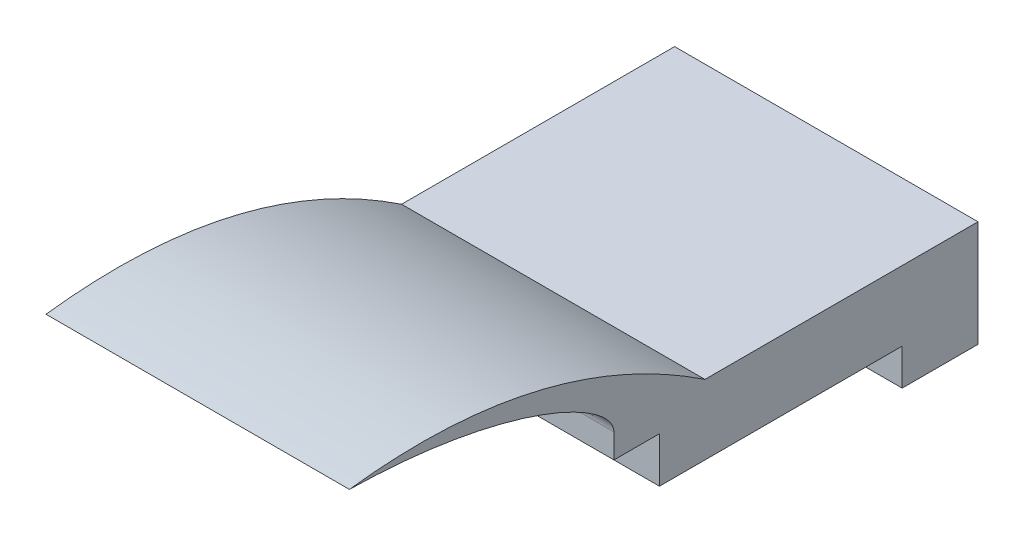
from build123d import *

# Parameters (mm, degrees)
BOSS_EXTRUDE1_DEPTH     = 63.5
CUT_EXTRUDE1_DEPTH      = 168.419011538
CUT_EXTRUDE1_DEPTH_BACK = 168.419011538
SKETCH2_R               = 3.175
BOSS_EXTRUDE2_START     = 114.3
SKETCH3_W               = 127
SKETCH3_H               = 44.45
SKETCH3_R               = 3.175
BOSS_EXTRUDE2_DEPTH     = 114.3
SKETCH4_W               = 101.6
SKETCH4_H               = 15.24
CUT_EXTRUDE2_DEPTH      = 211.546717743


with BuildPart() as part:
    # Sketch1 → Boss-Extrude1 (new, symmetric)
    with BuildSketch(Plane(origin=(0, 0, 0), x_dir=(0, 0, -1), z_dir=(1, 0, 0))):
        with BuildLine():
            Line((9.953260665, 1.527522938), (9.953260665, -8.632477062))
            Line((9.953260665, -8.632477062), (29.003260665, -8.632477062))
            Line((29.003260665, -8.632477062), (29.003260665, -42.922477062))
            Line((29.003260665, -42.922477062), (48.053260665, -42.922477062))
            Line((48.053260665, -42.922477062), (48.053260665, 1.527522938))
            add(Edge.make_bspline(
                [(-100.790739335, 36.068), (-19.032711445, 46.301406021), (48.053260665, 1.527522938)],
                knots=[0, 0, 0, 1, 1, 1], degree=2))
            add(Edge.make_bspline(
                [(-100.790739335, 36.068), (-95.472009051, 35.970053962), (-84.335207916, 35.497495721), (-67.84267644, 33.915291048), (-51.836102186, 31.40452262), (-37.369384582, 28.207814634), (-24.621041831, 24.500526142), (-13.737485443, 20.457861588), (-4.831226741, 16.256541913), (2.04810392, 12.063126076), (6.858444868, 7.976115249), (9.417519863, 4.43561678), (9.910164477, 2.202629327), (9.953260665, 1.527522938)],
                knots=[0.35379081, 0.35379081, 0.35379081, 0.35379081, 0.374279703, 0.396711254, 0.417576734, 0.436654006, 0.45374439, 0.468679994, 0.481329415, 0.491630702, 0.499615789, 0.505546281, 0.508115399, 0.508115399, 0.508115399, 0.508115399], degree=3))
        make_face()
    extrude(amount=BOSS_EXTRUDE1_DEPTH, both=True)

    # Sketch2 → Cut-Extrude1 (cut, two sides: drawn at the far end of the back side and taken through both)
    with BuildSketch(Plane(origin=(0, 0, -48.053260665), x_dir=(-1, 0, 0), z_dir=(0, 0, -1)).offset(-CUT_EXTRUDE1_DEPTH_BACK)):
        with Locations((-31.75, -19.300477062)):
            Circle(SKETCH2_R)
        with Locations((31.75, -19.300477062)):
            Circle(SKETCH2_R)
    extrude(amount=CUT_EXTRUDE1_DEPTH + CUT_EXTRUDE1_DEPTH_BACK, mode=Mode.SUBTRACT)

    # Sketch3 → Boss-Extrude2 (add)
    with BuildSketch(Plane(origin=(0, 0, -48.053260665), x_dir=(-1, 0, 0), z_dir=(0, 0, -1)).offset(BOSS_EXTRUDE2_START)):
        with Locations((0, -20.697477062)):
            Rectangle(SKETCH3_W, SKETCH3_H)
        with Locations((-31.75, -19.300477062)):
            Circle(SKETCH3_R, mode=Mode.SUBTRACT)
        with Locations((31.75, -19.300477062)):
            Circle(SKETCH3_R, mode=Mode.SUBTRACT)
    extrude(amount=-BOSS_EXTRUDE2_DEPTH)

    # Sketch4 → Cut-Extrude2 (cut, through all)
    with BuildSketch(Plane.ZY.offset(63.5)):
        with Locations((-79.803260665, -35.302477062)):
            Rectangle(SKETCH4_W, SKETCH4_H)
    extrude(amount=-CUT_EXTRUDE2_DEPTH, mode=Mode.SUBTRACT)


solid = part.part
